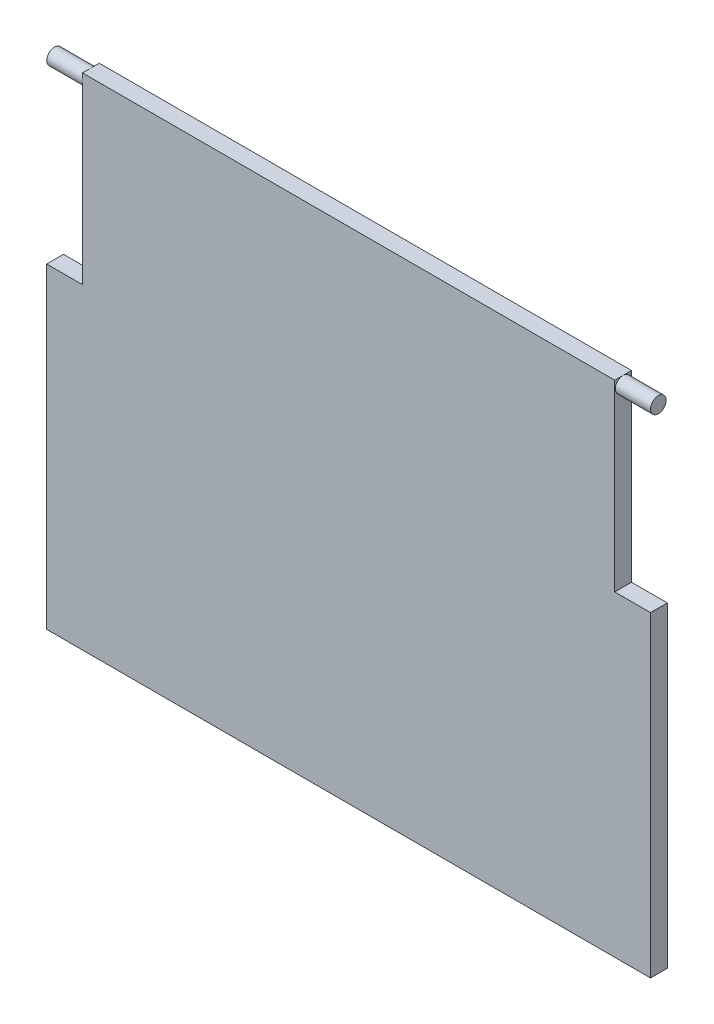
from build123d import *

# Parameters (mm, degrees)
BOSS_EXTRUDE1_DEPTH = 1.5
CUT_EXTRUDE5_START  = -3.25
CUT_EXTRUDE5_DEPTH  = 3.25
CUT_EXTRUDE6_START  = -54
CUT_EXTRUDE6_DEPTH  = 3.15


# Read off the part's stored shape, not the designer's step: Cut-Extrude6
with BuildPart() as part:
    # Sketch1 → Boss-Extrude1 (new body)
    with BuildSketch(Plane.XY):
        Polygon((47.6, -15), (47.6, 0), (50.75, 0), (50.75, 1.4), (42.5, 1.4), (5.1, 1.4), (-3.25, 1.4), (-3.25, 0), (0, 0), (0, -15), (-3.2, -15), (-3.2, -43.3), (50.8, -43.3), (50.8, -15), align=None)
    extrude(amount=BOSS_EXTRUDE1_DEPTH)

    # Sketch3 → Cut-Extrude5 (cut)
    with BuildSketch(Plane.ZY.offset(3.25).offset(CUT_EXTRUDE5_START)):
        with BuildLine():
            Line((0.75, 1.4), (0, 1.4))
            Line((0, 1.4), (0, 0))
            Line((0, 0), (0.75, 0))
            ThreePointArc((0.75, 0), (0.05, 0.7), (0.75, 1.4))
        make_face()
        with BuildLine():
            Line((1.5, 1.4), (0.75, 1.4))
            ThreePointArc((0.75, 1.4), (1.45, 0.7), (0.75, 0))
            Line((0.75, 0), (1.5, 0))
            Line((1.5, 0), (1.5, 1.4))
        make_face()
    extrude(amount=CUT_EXTRUDE5_DEPTH, mode=Mode.SUBTRACT)

    # Cut-Extrude6 outline → Cut-Extrude6 (cut)
    with BuildSketch(Plane.ZY.offset(3.25).offset(CUT_EXTRUDE6_START)):
        with BuildLine():
            ThreePointArc((0.75, 1.4), (1.45, 0.7), (0.75, 0))
            Line((0.75, 0), (1.5, 0))
            Line((1.5, 0), (1.5, 1.4))
            Line((1.5, 1.4), (0.75, 1.4))
        make_face()
        with BuildLine():
            ThreePointArc((0.75, 0), (0.05, 0.7), (0.75, 1.4))
            Line((0.75, 1.4), (0, 1.4))
            Line((0, 1.4), (0, 0))
            Line((0, 0), (0.75, 0))
        make_face()
    extrude(amount=CUT_EXTRUDE6_DEPTH, mode=Mode.SUBTRACT)


solid = part.part
